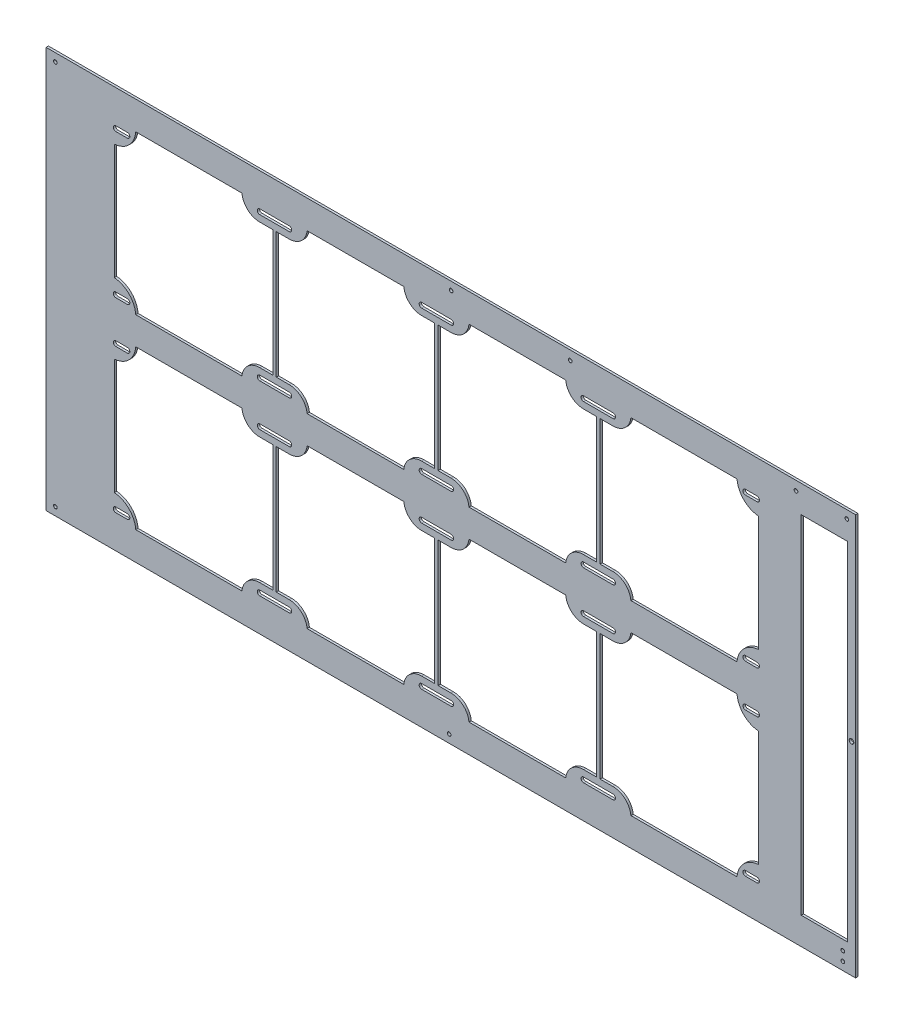
from build123d import *

# Parameters (mm, degrees)
SKETCH1_W          = 700
SKETCH1_H          = 347
SKETCH1_W_2        = 40
SKETCH1_H_2        = 300
BASE_FLANGE1_DEPTH = 2


# Read off the part's stored shape, not the designer's step: top.step
# Sheet-metal steps are written as plain solids
with BuildPart() as part:
    # Base-Flange1: sheet metal written as solids
    # Sketch1 → Base-Flange1 (new body)
    with BuildSketch(Plane.XY):
        with Locations((350, 173.5)):
            Rectangle(SKETCH1_W, SKETCH1_H)
        with BuildLine():
            Line((70.25, 32.9), (60.25, 32.9))
            ThreePointArc((60.25, 32.9), (58.72972042, 32.27027958), (58.1, 30.75))
            ThreePointArc((58.1, 30.75), (58.72972042, 29.22972042), (60.25, 28.6))
            Line((60.25, 28.6), (70.25, 28.6))
            ThreePointArc((70.25, 28.6), (71.77027958, 29.22972042), (72.4, 30.75))
            ThreePointArc((72.4, 30.75), (71.77027958, 32.27027958), (70.25, 32.9))
        make_face(mode=Mode.SUBTRACT)
        with BuildLine():
            Line((184.75, 28.6), (210.25, 28.6))
            ThreePointArc((210.25, 28.6), (211.77027958, 29.22972042), (212.4, 30.75))
            ThreePointArc((212.4, 30.75), (211.77027958, 32.27027958), (210.25, 32.9))
            Line((210.25, 32.9), (184.75, 32.9))
            ThreePointArc((184.75, 32.9), (183.22972042, 32.27027958), (182.6, 30.75))
            ThreePointArc((182.6, 30.75), (183.22972042, 29.22972042), (184.75, 28.6))
        make_face(mode=Mode.SUBTRACT)
        with BuildLine():
            Line((324.75, 28.6), (350.25, 28.6))
            ThreePointArc((350.25, 28.6), (351.77027958, 29.22972042), (352.4, 30.75))
            ThreePointArc((352.4, 30.75), (351.77027958, 32.27027958), (350.25, 32.9))
            Line((350.25, 32.9), (324.75, 32.9))
            ThreePointArc((324.75, 32.9), (323.22972042, 32.27027958), (322.6, 30.75))
            ThreePointArc((322.6, 30.75), (323.22972042, 29.22972042), (324.75, 28.6))
        make_face(mode=Mode.SUBTRACT)
        with BuildLine():
            Line((464.75, 28.6), (490.25, 28.6))
            ThreePointArc((490.25, 28.6), (491.77027958, 29.22972042), (492.4, 30.75))
            ThreePointArc((492.4, 30.75), (491.77027958, 32.27027958), (490.25, 32.9))
            Line((490.25, 32.9), (464.75, 32.9))
            ThreePointArc((464.75, 32.9), (463.22972042, 32.27027958), (462.6, 30.75))
            ThreePointArc((462.6, 30.75), (463.22972042, 29.22972042), (464.75, 28.6))
        make_face(mode=Mode.SUBTRACT)
        with BuildLine():
            Line((614.75, 32.9), (604.75, 32.9))
            ThreePointArc((604.75, 32.9), (603.22972042, 32.27027958), (602.6, 30.75))
            ThreePointArc((602.6, 30.75), (603.22972042, 29.22972042), (604.75, 28.6))
            Line((604.75, 28.6), (614.75, 28.6))
            ThreePointArc((614.75, 28.6), (616.27027958, 29.22972042), (616.9, 30.75))
            ThreePointArc((616.9, 30.75), (616.27027958, 32.27027958), (614.75, 32.9))
        make_face(mode=Mode.SUBTRACT)
        with BuildLine():
            Line((604.75, 153.1), (614.75, 153.1))
            ThreePointArc((614.75, 153.1), (616.27027958, 153.72972042), (616.9, 155.25))
            ThreePointArc((616.9, 155.25), (616.27027958, 156.77027958), (614.75, 157.4))
            Line((614.75, 157.4), (604.75, 157.4))
            ThreePointArc((604.75, 157.4), (603.22972042, 156.77027958), (602.6, 155.25))
            ThreePointArc((602.6, 155.25), (603.22972042, 153.72972042), (604.75, 153.1))
        make_face(mode=Mode.SUBTRACT)
        with BuildLine():
            Line((490.25, 157.4), (464.75, 157.4))
            ThreePointArc((464.75, 157.4), (463.22972042, 156.77027958), (462.6, 155.25))
            ThreePointArc((462.6, 155.25), (463.22972042, 153.72972042), (464.75, 153.1))
            Line((464.75, 153.1), (490.25, 153.1))
            ThreePointArc((490.25, 153.1), (491.77027958, 153.72972042), (492.4, 155.25))
            ThreePointArc((492.4, 155.25), (491.77027958, 156.77027958), (490.25, 157.4))
        make_face(mode=Mode.SUBTRACT)
        with BuildLine():
            Line((350.25, 157.4), (324.75, 157.4))
            ThreePointArc((324.75, 157.4), (323.22972042, 156.77027958), (322.6, 155.25))
            ThreePointArc((322.6, 155.25), (323.22972042, 153.72972042), (324.75, 153.1))
            Line((324.75, 153.1), (350.25, 153.1))
            ThreePointArc((350.25, 153.1), (351.77027958, 153.72972042), (352.4, 155.25))
            ThreePointArc((352.4, 155.25), (351.77027958, 156.77027958), (350.25, 157.4))
        make_face(mode=Mode.SUBTRACT)
        with BuildLine():
            Line((490.25, 147.5), (479, 147.5))
            Line((479, 147.5), (479, 93))
            Line((479, 93), (479, 38.5))
            Line((479, 38.5), (490.25, 38.5))
            ThreePointArc((490.25, 38.5), (500.666333328, 34.478240283), (505.67724862, 24.5))
            Line((505.67724862, 24.5), (547.5, 24.5))
            Line((547.5, 24.5), (597.5, 24.5))
            ThreePointArc((597.5, 24.5), (603.318145396, 37.181854604), (616, 43))
            Line((616, 43), (616, 143))
            ThreePointArc((616, 143), (603.318145396, 148.818145396), (597.5, 161.5))
            Line((597.5, 161.5), (547.5, 161.5))
            Line((547.5, 161.5), (505.67724862, 161.5))
            ThreePointArc((505.67724862, 161.5), (500.666333328, 151.521759717), (490.25, 147.5))
        make_face(mode=Mode.SUBTRACT)
        with BuildLine():
            Line((210.25, 157.4), (184.75, 157.4))
            ThreePointArc((184.75, 157.4), (183.22972042, 156.77027958), (182.6, 155.25))
            ThreePointArc((182.6, 155.25), (183.22972042, 153.72972042), (184.75, 153.1))
            Line((184.75, 153.1), (210.25, 153.1))
            ThreePointArc((210.25, 153.1), (211.77027958, 153.72972042), (212.4, 155.25))
            ThreePointArc((212.4, 155.25), (211.77027958, 156.77027958), (210.25, 157.4))
        make_face(mode=Mode.SUBTRACT)
        with BuildLine():
            Line((476, 147.5), (464.75, 147.5))
            ThreePointArc((464.75, 147.5), (454.333666672, 151.521759717), (449.32275138, 161.5))
            Line((449.32275138, 161.5), (407.5, 161.5))
            Line((407.5, 161.5), (365.67724862, 161.5))
            ThreePointArc((365.67724862, 161.5), (360.666333328, 151.521759717), (350.25, 147.5))
            Line((350.25, 147.5), (339, 147.5))
            Line((339, 147.5), (339, 93))
            Line((339, 93), (339, 38.5))
            Line((339, 38.5), (350.25, 38.5))
            ThreePointArc((350.25, 38.5), (360.666333328, 34.478240283), (365.67724862, 24.5))
            Line((365.67724862, 24.5), (407.5, 24.5))
            Line((407.5, 24.5), (449.32275138, 24.5))
            ThreePointArc((449.32275138, 24.5), (454.333666672, 34.478240283), (464.75, 38.5))
            Line((464.75, 38.5), (476, 38.5))
            Line((476, 38.5), (476, 93))
            Line((476, 93), (476, 147.5))
        make_face(mode=Mode.SUBTRACT)
        with BuildLine():
            Line((60.25, 153.1), (70.25, 153.1))
            ThreePointArc((70.25, 153.1), (71.77027958, 153.72972042), (72.4, 155.25))
            ThreePointArc((72.4, 155.25), (71.77027958, 156.77027958), (70.25, 157.4))
            Line((70.25, 157.4), (60.25, 157.4))
            ThreePointArc((60.25, 157.4), (58.72972042, 156.77027958), (58.1, 155.25))
            ThreePointArc((58.1, 155.25), (58.72972042, 153.72972042), (60.25, 153.1))
        make_face(mode=Mode.SUBTRACT)
        with BuildLine():
            Line((336, 147.5), (324.75, 147.5))
            ThreePointArc((324.75, 147.5), (314.333666672, 151.521759717), (309.32275138, 161.5))
            Line((309.32275138, 161.5), (267.5, 161.5))
            Line((267.5, 161.5), (225.67724862, 161.5))
            ThreePointArc((225.67724862, 161.5), (220.666333328, 151.521759717), (210.25, 147.5))
            Line((210.25, 147.5), (199, 147.5))
            Line((199, 147.5), (199, 93))
            Line((199, 93), (199, 38.5))
            Line((199, 38.5), (210.25, 38.5))
            ThreePointArc((210.25, 38.5), (220.666333328, 34.478240283), (225.677248621, 24.5))
            Line((225.677248621, 24.5), (267.5, 24.5))
            Line((267.5, 24.5), (309.32275138, 24.5))
            ThreePointArc((309.32275138, 24.5), (314.333666672, 34.478240283), (324.75, 38.5))
            Line((324.75, 38.5), (336, 38.5))
            Line((336, 38.5), (336, 93))
            Line((336, 93), (336, 147.5))
        make_face(mode=Mode.SUBTRACT)
        with BuildLine():
            Line((464.75, 189.6), (490.25, 189.6))
            ThreePointArc((490.25, 189.6), (491.77027958, 190.22972042), (492.4, 191.75))
            ThreePointArc((492.4, 191.75), (491.77027958, 193.27027958), (490.25, 193.9))
            Line((490.25, 193.9), (464.75, 193.9))
            ThreePointArc((464.75, 193.9), (463.22972042, 193.27027958), (462.6, 191.75))
            ThreePointArc((462.6, 191.75), (463.22972042, 190.22972042), (464.75, 189.6))
        make_face(mode=Mode.SUBTRACT)
        with BuildLine():
            Line((196, 147.5), (184.75, 147.5))
            ThreePointArc((184.75, 147.5), (174.333666672, 151.521759717), (169.322751379, 161.5))
            Line((169.322751379, 161.5), (127.5, 161.5))
            Line((127.5, 161.5), (77.5, 161.5))
            ThreePointArc((77.5, 161.5), (71.681854604, 148.818145396), (59, 143))
            Line((59, 143), (59, 43))
            ThreePointArc((59, 43), (71.681854604, 37.181854604), (77.5, 24.5))
            Line((77.5, 24.5), (127.5, 24.5))
            Line((127.5, 24.5), (169.32275138, 24.5))
            ThreePointArc((169.32275138, 24.5), (174.333666672, 34.478240283), (184.75, 38.5))
            Line((184.75, 38.5), (196, 38.5))
            Line((196, 38.5), (196, 93))
            Line((196, 93), (196, 147.5))
        make_face(mode=Mode.SUBTRACT)
        with BuildLine():
            Line((614.75, 193.9), (604.75, 193.9))
            ThreePointArc((604.75, 193.9), (603.22972042, 193.27027958), (602.6, 191.75))
            ThreePointArc((602.6, 191.75), (603.22972042, 190.22972042), (604.75, 189.6))
            Line((604.75, 189.6), (614.75, 189.6))
            ThreePointArc((614.75, 189.6), (616.27027958, 190.22972042), (616.9, 191.75))
            ThreePointArc((616.9, 191.75), (616.27027958, 193.27027958), (614.75, 193.9))
        make_face(mode=Mode.SUBTRACT)
        with BuildLine():
            Line((604.75, 314.1), (614.75, 314.1))
            ThreePointArc((614.75, 314.1), (616.27027958, 314.72972042), (616.9, 316.25))
            ThreePointArc((616.9, 316.25), (616.27027958, 317.77027958), (614.75, 318.4))
            Line((614.75, 318.4), (604.75, 318.4))
            ThreePointArc((604.75, 318.4), (603.22972042, 317.77027958), (602.6, 316.25))
            ThreePointArc((602.6, 316.25), (603.22972042, 314.72972042), (604.75, 314.1))
        make_face(mode=Mode.SUBTRACT)
        with BuildLine():
            Line((490.25, 318.4), (464.75, 318.4))
            ThreePointArc((464.75, 318.4), (463.22972042, 317.77027958), (462.6, 316.25))
            ThreePointArc((462.6, 316.25), (463.22972042, 314.72972042), (464.75, 314.1))
            Line((464.75, 314.1), (490.25, 314.1))
            ThreePointArc((490.25, 314.1), (491.77027958, 314.72972042), (492.4, 316.25))
            ThreePointArc((492.4, 316.25), (491.77027958, 317.77027958), (490.25, 318.4))
        make_face(mode=Mode.SUBTRACT)
        with BuildLine():
            Line((324.75, 189.6), (350.25, 189.6))
            ThreePointArc((350.25, 189.6), (351.77027958, 190.22972042), (352.4, 191.75))
            ThreePointArc((352.4, 191.75), (351.77027958, 193.27027958), (350.25, 193.9))
            Line((350.25, 193.9), (324.75, 193.9))
            ThreePointArc((324.75, 193.9), (323.22972042, 193.27027958), (322.6, 191.75))
            ThreePointArc((322.6, 191.75), (323.22972042, 190.22972042), (324.75, 189.6))
        make_face(mode=Mode.SUBTRACT)
        with BuildLine():
            Line((490.25, 308.5), (479, 308.5))
            Line((479, 308.5), (479, 254))
            Line((479, 254), (479, 199.5))
            Line((479, 199.5), (490.25, 199.5))
            ThreePointArc((490.25, 199.5), (500.666333328, 195.478240283), (505.67724862, 185.5))
            Line((505.67724862, 185.5), (547.5, 185.5))
            Line((547.5, 185.5), (597.5, 185.5))
            ThreePointArc((597.5, 185.5), (603.318145396, 198.181854604), (616, 204))
            Line((616, 204), (616, 304))
            ThreePointArc((616, 304), (603.318145396, 309.818145396), (597.5, 322.5))
            Line((597.5, 322.5), (547.5, 322.5))
            Line((547.5, 322.5), (505.67724862, 322.5))
            ThreePointArc((505.67724862, 322.5), (500.666333328, 312.521759717), (490.25, 308.5))
        make_face(mode=Mode.SUBTRACT)
        with BuildLine():
            Line((70.25, 193.9), (60.25, 193.9))
            ThreePointArc((60.25, 193.9), (58.72972042, 193.27027958), (58.1, 191.75))
            ThreePointArc((58.1, 191.75), (58.72972042, 190.22972042), (60.25, 189.6))
            Line((60.25, 189.6), (70.25, 189.6))
            ThreePointArc((70.25, 189.6), (71.77027958, 190.22972042), (72.4, 191.75))
            ThreePointArc((72.4, 191.75), (71.77027958, 193.27027958), (70.25, 193.9))
        make_face(mode=Mode.SUBTRACT)
        with BuildLine():
            Line((476, 308.5), (464.75, 308.5))
            ThreePointArc((464.75, 308.5), (454.333666672, 312.521759717), (449.32275138, 322.5))
            Line((449.32275138, 322.5), (407.5, 322.5))
            Line((407.5, 322.5), (365.67724862, 322.5))
            ThreePointArc((365.67724862, 322.5), (360.666333328, 312.521759717), (350.25, 308.5))
            Line((350.25, 308.5), (339, 308.5))
            Line((339, 308.5), (339, 254))
            Line((339, 254), (339, 199.5))
            Line((339, 199.5), (350.25, 199.5))
            ThreePointArc((350.25, 199.5), (360.666333328, 195.478240283), (365.67724862, 185.5))
            Line((365.67724862, 185.5), (407.5, 185.5))
            Line((407.5, 185.5), (449.32275138, 185.5))
            ThreePointArc((449.32275138, 185.5), (454.333666672, 195.478240283), (464.75, 199.5))
            Line((464.75, 199.5), (476, 199.5))
            Line((476, 199.5), (476, 254))
            Line((476, 254), (476, 308.5))
        make_face(mode=Mode.SUBTRACT)
        with BuildLine():
            Line((184.75, 189.6), (210.25, 189.6))
            ThreePointArc((210.25, 189.6), (211.77027958, 190.22972042), (212.4, 191.75))
            ThreePointArc((212.4, 191.75), (211.77027958, 193.27027958), (210.25, 193.9))
            Line((210.25, 193.9), (184.75, 193.9))
            ThreePointArc((184.75, 193.9), (183.22972042, 193.27027958), (182.6, 191.75))
            ThreePointArc((182.6, 191.75), (183.22972042, 190.22972042), (184.75, 189.6))
        make_face(mode=Mode.SUBTRACT)
        with BuildLine():
            Line((350.25, 318.4), (324.75, 318.4))
            ThreePointArc((324.75, 318.4), (323.22972042, 317.77027958), (322.6, 316.25))
            ThreePointArc((322.6, 316.25), (323.22972042, 314.72972042), (324.75, 314.1))
            Line((324.75, 314.1), (350.25, 314.1))
            ThreePointArc((350.25, 314.1), (351.77027958, 314.72972042), (352.4, 316.25))
            ThreePointArc((352.4, 316.25), (351.77027958, 317.77027958), (350.25, 318.4))
        make_face(mode=Mode.SUBTRACT)
        with BuildLine():
            Line((210.25, 318.4), (184.75, 318.4))
            ThreePointArc((184.75, 318.4), (183.22972042, 317.77027958), (182.6, 316.25))
            ThreePointArc((182.6, 316.25), (183.22972042, 314.72972042), (184.75, 314.1))
            Line((184.75, 314.1), (210.25, 314.1))
            ThreePointArc((210.25, 314.1), (211.77027958, 314.72972042), (212.4, 316.25))
            ThreePointArc((212.4, 316.25), (211.77027958, 317.77027958), (210.25, 318.4))
        make_face(mode=Mode.SUBTRACT)
        with BuildLine():
            Line((60.25, 314.1), (70.25, 314.1))
            ThreePointArc((70.25, 314.1), (71.77027958, 314.72972042), (72.4, 316.25))
            ThreePointArc((72.4, 316.25), (71.77027958, 317.77027958), (70.25, 318.4))
            Line((70.25, 318.4), (60.25, 318.4))
            ThreePointArc((60.25, 318.4), (58.72972042, 317.77027958), (58.1, 316.25))
            ThreePointArc((58.1, 316.25), (58.72972042, 314.72972042), (60.25, 314.1))
        make_face(mode=Mode.SUBTRACT)
        with BuildLine():
            Line((336, 308.5), (324.75, 308.5))
            ThreePointArc((324.75, 308.5), (314.333666672, 312.521759717), (309.32275138, 322.5))
            Line((309.32275138, 322.5), (267.5, 322.5))
            Line((267.5, 322.5), (225.67724862, 322.5))
            ThreePointArc((225.67724862, 322.5), (220.666333328, 312.521759717), (210.25, 308.5))
            Line((210.25, 308.5), (199, 308.5))
            Line((199, 308.5), (199, 254))
            Line((199, 254), (199, 199.5))
            Line((199, 199.5), (210.25, 199.5))
            ThreePointArc((210.25, 199.5), (220.666333328, 195.478240283), (225.677248621, 185.5))
            Line((225.677248621, 185.5), (267.5, 185.5))
            Line((267.5, 185.5), (309.32275138, 185.5))
            ThreePointArc((309.32275138, 185.5), (314.333666672, 195.478240283), (324.75, 199.5))
            Line((324.75, 199.5), (336, 199.5))
            Line((336, 199.5), (336, 254))
            Line((336, 254), (336, 308.5))
        make_face(mode=Mode.SUBTRACT)
        with BuildLine():
            Line((196, 308.5), (184.75, 308.5))
            ThreePointArc((184.75, 308.5), (174.333666672, 312.521759717), (169.322751379, 322.5))
            Line((169.322751379, 322.5), (127.5, 322.5))
            Line((127.5, 322.5), (77.5, 322.5))
            ThreePointArc((77.5, 322.5), (71.681854604, 309.818145396), (59, 304))
            Line((59, 304), (59, 204))
            ThreePointArc((59, 204), (71.681854604, 198.181854604), (77.5, 185.5))
            Line((77.5, 185.5), (127.5, 185.5))
            Line((127.5, 185.5), (169.32275138, 185.5))
            ThreePointArc((169.32275138, 185.5), (174.333666672, 195.478240283), (184.75, 199.5))
            Line((184.75, 199.5), (196, 199.5))
            Line((196, 199.5), (196, 254))
            Line((196, 254), (196, 308.5))
        make_face(mode=Mode.SUBTRACT)
        with Locations((673, 173.5)):
            Rectangle(SKETCH1_W_2, SKETCH1_H_2, mode=Mode.SUBTRACT)
        with BuildLine():
            add(Edge.make_bspline(
                [(9.6, 7), (9.599144796, 7.04043287), (9.597441601, 7.120957526), (9.583449234, 7.240793796), (9.561050517, 7.358924454), (9.529434689, 7.475353212), (9.46628832, 7.653854822), (9.347212978, 7.884948009), (9.139077952, 8.138958261), (8.885002964, 8.347138577), (8.630089511, 8.478661896), (8.39905452, 8.553787683), (8.201116482, 8.592917963), (8.067225889, 8.597632734), (8, 8.6)],
                knots=[0, 0, 0, 0, 0.048300702, 0.096193949, 0.143954901, 0.191860997, 0.24018718, 0.370073141, 0.500049556, 0.629923419, 0.759911847, 0.840126742, 0.919728328, 1, 1, 1, 1], degree=3))
            add(Edge.make_bspline(
                [(8, 8.6), (7.959573718, 8.599144722), (7.879058925, 8.597441312), (7.759232655, 8.583448437), (7.641102154, 8.561049558), (7.524664006, 8.529432932), (7.34615859, 8.466299068), (7.115054797, 8.347226567), (6.861043824, 8.139075913), (6.652847378, 7.885000304), (6.521328201, 7.630072821), (6.446216726, 7.399034858), (6.407083189, 7.201098259), (6.402367544, 7.067216771), (6.4, 7)],
                knots=[0, 0, 0, 0, 0.048292834, 0.09618217, 0.143943123, 0.191853023, 0.240186632, 0.370060815, 0.500049535, 0.629935723, 0.759912354, 0.840137637, 0.919739226, 1, 1, 1, 1], degree=3))
            add(Edge.make_bspline(
                [(6.4, 7), (6.400855204, 6.95956713), (6.402558399, 6.879042474), (6.416550766, 6.759206204), (6.438949483, 6.641075546), (6.470565311, 6.524646788), (6.53371168, 6.346145178), (6.652787022, 6.115051991), (6.860922048, 5.861041739), (7.114997036, 5.652861423), (7.369910489, 5.521338104), (7.60094548, 5.446212317), (7.798883518, 5.407082037), (7.932774111, 5.402367266), (8, 5.4)],
                knots=[0, 0, 0, 0, 0.048300702, 0.096193949, 0.143954901, 0.191860997, 0.24018718, 0.370073141, 0.500049556, 0.629923419, 0.759911847, 0.840126742, 0.919728328, 1, 1, 1, 1], degree=3))
            add(Edge.make_bspline(
                [(8, 5.4), (8.040426282, 5.400855278), (8.120941075, 5.402558688), (8.240767345, 5.416551563), (8.358897846, 5.438950442), (8.475335994, 5.470567068), (8.65384141, 5.533700932), (8.884945203, 5.652773433), (9.138956176, 5.860924087), (9.347152622, 6.114999696), (9.478671799, 6.369927179), (9.553783274, 6.600965142), (9.592916811, 6.798901741), (9.597632456, 6.932783229), (9.6, 7)],
                knots=[0, 0, 0, 0, 0.048292834, 0.09618217, 0.143943123, 0.191853023, 0.240186632, 0.370060815, 0.500049535, 0.629935723, 0.759912354, 0.840137637, 0.919739226, 1, 1, 1, 1], degree=3))
        make_face(mode=Mode.SUBTRACT)
        with BuildLine():
            add(Edge.make_bspline(
                [(350.1, 7), (350.099144796, 7.04043287), (350.097441601, 7.120957526), (350.083449234, 7.240793796), (350.061050517, 7.358924454), (350.029434689, 7.475353212), (349.96628832, 7.653854822), (349.847212978, 7.884948009), (349.639077952, 8.138958261), (349.385002964, 8.347138577), (349.130089511, 8.478661896), (348.89905452, 8.553787683), (348.701116482, 8.592917963), (348.567225889, 8.597632734), (348.5, 8.6)],
                knots=[0, 0, 0, 0, 0.048300702, 0.096193949, 0.143954901, 0.191860997, 0.24018718, 0.370073141, 0.500049556, 0.629923419, 0.759911847, 0.840126742, 0.919728328, 1, 1, 1, 1], degree=3))
            add(Edge.make_bspline(
                [(348.5, 8.6), (348.459573718, 8.599144722), (348.379058925, 8.597441312), (348.259232655, 8.583448437), (348.141102154, 8.561049558), (348.024664006, 8.529432932), (347.84615859, 8.466299068), (347.615054797, 8.347226567), (347.361043824, 8.139075913), (347.152847378, 7.885000304), (347.021328201, 7.630072821), (346.946216726, 7.399034858), (346.907083189, 7.201098259), (346.902367544, 7.067216771), (346.9, 7)],
                knots=[0, 0, 0, 0, 0.048292834, 0.09618217, 0.143943123, 0.191853023, 0.240186632, 0.370060815, 0.500049535, 0.629935723, 0.759912354, 0.840137637, 0.919739226, 1, 1, 1, 1], degree=3))
            add(Edge.make_bspline(
                [(346.9, 7), (346.900855204, 6.95956713), (346.902558399, 6.879042474), (346.916550766, 6.759206204), (346.938949483, 6.641075546), (346.970565311, 6.524646788), (347.03371168, 6.346145178), (347.152787022, 6.115051991), (347.360922048, 5.861041739), (347.614997036, 5.652861423), (347.869910489, 5.521338104), (348.10094548, 5.446212317), (348.298883518, 5.407082037), (348.432774111, 5.402367266), (348.5, 5.4)],
                knots=[0, 0, 0, 0, 0.048300702, 0.096193949, 0.143954901, 0.191860997, 0.24018718, 0.370073141, 0.500049556, 0.629923419, 0.759911847, 0.840126742, 0.919728328, 1, 1, 1, 1], degree=3))
            add(Edge.make_bspline(
                [(348.5, 5.4), (348.540426282, 5.400855278), (348.620941075, 5.402558688), (348.740767345, 5.416551563), (348.858897846, 5.438950442), (348.975335994, 5.470567068), (349.15384141, 5.533700932), (349.384945203, 5.652773433), (349.638956176, 5.860924087), (349.847152622, 6.114999696), (349.978671799, 6.369927179), (350.053783274, 6.600965142), (350.092916811, 6.798901741), (350.097632456, 6.932783229), (350.1, 7)],
                knots=[0, 0, 0, 0, 0.048292834, 0.09618217, 0.143943124, 0.191853023, 0.240186632, 0.370060815, 0.500049535, 0.629935723, 0.759912354, 0.840137637, 0.919739226, 1, 1, 1, 1], degree=3))
        make_face(mode=Mode.SUBTRACT)
        with BuildLine():
            add(Edge.make_bspline(
                [(690.6, 7), (690.599144796, 7.04043287), (690.597441601, 7.120957526), (690.583449234, 7.240793797), (690.561050517, 7.358924454), (690.529434689, 7.475353212), (690.46628832, 7.653854822), (690.347212978, 7.884948009), (690.139077952, 8.138958261), (689.885002964, 8.347138577), (689.630089511, 8.478661896), (689.39905452, 8.553787683), (689.201116482, 8.592917963), (689.067225889, 8.597632734), (689, 8.6)],
                knots=[0, 0, 0, 0, 0.048300702, 0.096193949, 0.143954901, 0.191860997, 0.24018718, 0.370073141, 0.500049556, 0.629923419, 0.759911847, 0.840126742, 0.919728328, 1, 1, 1, 1], degree=3))
            add(Edge.make_bspline(
                [(689, 8.6), (688.959573718, 8.599144722), (688.879058925, 8.597441312), (688.759232655, 8.583448437), (688.641102154, 8.561049558), (688.524664006, 8.529432932), (688.34615859, 8.466299068), (688.115054797, 8.347226567), (687.861043824, 8.139075913), (687.652847378, 7.885000304), (687.521328201, 7.630072821), (687.446216726, 7.399034858), (687.407083189, 7.201098259), (687.402367544, 7.067216771), (687.4, 7)],
                knots=[0, 0, 0, 0, 0.048292834, 0.09618217, 0.143943123, 0.191853023, 0.240186632, 0.370060815, 0.500049535, 0.629935723, 0.759912354, 0.840137637, 0.919739226, 1, 1, 1, 1], degree=3))
            add(Edge.make_bspline(
                [(687.4, 7), (687.400855204, 6.95956713), (687.402558399, 6.879042474), (687.416550766, 6.759206204), (687.438949483, 6.641075546), (687.470565311, 6.524646788), (687.53371168, 6.346145178), (687.652787022, 6.115051991), (687.860922048, 5.861041739), (688.114997036, 5.652861423), (688.369910489, 5.521338104), (688.60094548, 5.446212317), (688.798883518, 5.407082037), (688.932774111, 5.402367266), (689, 5.4)],
                knots=[0, 0, 0, 0, 0.048300702, 0.096193949, 0.143954901, 0.191860997, 0.24018718, 0.370073141, 0.500049556, 0.629923419, 0.759911847, 0.840126742, 0.919728328, 1, 1, 1, 1], degree=3))
            add(Edge.make_bspline(
                [(689, 5.4), (689.040426282, 5.400855278), (689.120941075, 5.402558688), (689.240767345, 5.416551563), (689.358897846, 5.438950442), (689.475335994, 5.470567068), (689.65384141, 5.533700932), (689.884945203, 5.652773433), (690.138956176, 5.860924087), (690.347152622, 6.114999696), (690.478671799, 6.369927179), (690.553783274, 6.600965142), (690.592916811, 6.798901741), (690.597632456, 6.932783229), (690.6, 7)],
                knots=[0, 0, 0, 0, 0.048292834, 0.09618217, 0.143943124, 0.191853023, 0.240186632, 0.370060815, 0.500049535, 0.629935723, 0.759912354, 0.840137637, 0.919739226, 1, 1, 1, 1], degree=3))
        make_face(mode=Mode.SUBTRACT)
        with BuildLine():
            add(Edge.make_bspline(
                [(690.6, 15), (690.599144796, 15.04043287), (690.597441601, 15.120957526), (690.583449234, 15.240793797), (690.561050517, 15.358924454), (690.529434689, 15.475353212), (690.46628832, 15.653854822), (690.347212978, 15.884948009), (690.139077952, 16.138958261), (689.885002964, 16.347138577), (689.630089511, 16.478661896), (689.39905452, 16.553787683), (689.201116482, 16.592917963), (689.067225889, 16.597632734), (689, 16.6)],
                knots=[0, 0, 0, 0, 0.048300702, 0.096193949, 0.143954901, 0.191860997, 0.24018718, 0.370073141, 0.500049556, 0.629923419, 0.759911847, 0.840126742, 0.919728328, 1, 1, 1, 1], degree=3))
            add(Edge.make_bspline(
                [(689, 16.6), (688.959573718, 16.599144722), (688.879058925, 16.597441312), (688.759232655, 16.583448437), (688.641102154, 16.561049558), (688.524664006, 16.529432932), (688.34615859, 16.466299068), (688.115054797, 16.347226567), (687.861043824, 16.139075913), (687.652847378, 15.885000304), (687.521328201, 15.630072821), (687.446216726, 15.399034858), (687.407083189, 15.201098259), (687.402367544, 15.067216771), (687.4, 15)],
                knots=[0, 0, 0, 0, 0.048292834, 0.09618217, 0.143943123, 0.191853023, 0.240186632, 0.370060815, 0.500049535, 0.629935723, 0.759912354, 0.840137637, 0.919739226, 1, 1, 1, 1], degree=3))
            add(Edge.make_bspline(
                [(687.4, 15), (687.400855204, 14.95956713), (687.402558399, 14.879042474), (687.416550766, 14.759206203), (687.438949483, 14.641075546), (687.470565311, 14.524646788), (687.53371168, 14.346145178), (687.652787022, 14.115051991), (687.860922048, 13.861041739), (688.114997037, 13.652861423), (688.369910489, 13.521338104), (688.60094548, 13.446212317), (688.798883518, 13.407082037), (688.932774111, 13.402367266), (689, 13.4)],
                knots=[0, 0, 0, 0, 0.048300702, 0.096193949, 0.143954901, 0.191860997, 0.24018718, 0.370073141, 0.500049556, 0.629923419, 0.759911847, 0.840126742, 0.919728328, 1, 1, 1, 1], degree=3))
            add(Edge.make_bspline(
                [(689, 13.4), (689.040426282, 13.400855278), (689.120941075, 13.402558688), (689.240767345, 13.416551563), (689.358897846, 13.438950442), (689.475335994, 13.470567068), (689.65384141, 13.533700932), (689.884945203, 13.652773433), (690.138956176, 13.860924087), (690.347152622, 14.114999696), (690.478671799, 14.369927179), (690.553783274, 14.600965142), (690.592916811, 14.798901741), (690.597632456, 14.932783229), (690.6, 15)],
                knots=[0, 0, 0, 0, 0.048292834, 0.09618217, 0.143943124, 0.191853023, 0.240186632, 0.370060815, 0.500049535, 0.629935723, 0.759912354, 0.840137637, 0.919739226, 1, 1, 1, 1], degree=3))
        make_face(mode=Mode.SUBTRACT)
        with BuildLine():
            add(Edge.make_bspline(
                [(696.5, 177.5), (696.457848659, 177.499256604), (696.373873685, 177.497775593), (696.248720384, 177.485640525), (696.125036498, 177.466220056), (696.00283133, 177.438823398), (695.882096956, 177.403624251), (695.675188909, 177.328994717), (695.393801952, 177.184025771), (695.076291088, 176.923829938), (694.816054893, 176.606241283), (694.65165374, 176.287579454), (694.557772895, 175.998785275), (694.508854428, 175.751365255), (694.502959534, 175.584017173), (694.5, 175.5)],
                knots=[0, 0, 0, 0, 0.04028519, 0.080257179, 0.120074508, 0.159897561, 0.199886658, 0.240200133, 0.370083477, 0.500058452, 0.629951402, 0.759916706, 0.840144054, 0.919744257, 1, 1, 1, 1], degree=3))
            add(Edge.make_bspline(
                [(694.5, 175.5), (694.500743352, 175.45784294), (694.502224235, 175.37385883), (694.514359036, 175.248695193), (694.533779296, 175.125007771), (694.561175862, 175.002805927), (694.596374496, 174.882081523), (694.671016167, 174.67517651), (694.815987683, 174.393799091), (695.076168063, 174.076289015), (695.393756047, 173.816068931), (695.712403857, 173.651663643), (696.001195061, 173.557768486), (696.248616519, 173.508853276), (696.415973708, 173.502959256), (696.5, 173.5)],
                knots=[0, 0, 0, 0, 0.040290654, 0.080265908, 0.120084315, 0.1599063, 0.199892245, 0.240200575, 0.370093343, 0.500058472, 0.629941562, 0.759916301, 0.840135338, 0.919735539, 1, 1, 1, 1], degree=3))
            add(Edge.make_bspline(
                [(696.5, 173.5), (696.542151341, 173.500743396), (696.626126315, 173.502224407), (696.751279616, 173.514359475), (696.874963502, 173.533779944), (696.99716867, 173.561176602), (697.117903044, 173.596375749), (697.32481109, 173.671005283), (697.606198048, 173.815974229), (697.923708912, 174.076170062), (698.183945108, 174.393758717), (698.34834626, 174.712420546), (698.442227105, 175.001214725), (698.491145572, 175.248634745), (698.497040466, 175.415982827), (698.5, 175.5)],
                knots=[0, 0, 0, 0, 0.04028519, 0.080257179, 0.120074508, 0.159897561, 0.199886658, 0.240200133, 0.370083477, 0.500058452, 0.629951402, 0.759916706, 0.840144054, 0.919744257, 1, 1, 1, 1], degree=3))
            add(Edge.make_bspline(
                [(698.5, 175.5), (698.499256648, 175.54215706), (698.497775765, 175.626141171), (698.485640964, 175.751304807), (698.466220704, 175.87499223), (698.438824138, 175.997194073), (698.403625504, 176.117918478), (698.328983833, 176.32482349), (698.184012317, 176.606200909), (697.923831937, 176.923710985), (697.606243953, 177.183931069), (697.287596143, 177.348336357), (696.998804939, 177.442231514), (696.751383481, 177.491146724), (696.584026292, 177.497040744), (696.5, 177.5)],
                knots=[0, 0, 0, 0, 0.040290654, 0.080265908, 0.120084316, 0.159906301, 0.199892245, 0.240200575, 0.370093343, 0.500058472, 0.629941562, 0.759916301, 0.840135338, 0.919735539, 1, 1, 1, 1], degree=3))
        make_face(mode=Mode.SUBTRACT)
        with BuildLine():
            add(Edge.make_bspline(
                [(694.1, 340), (694.099144796, 340.04043287), (694.097441601, 340.120957526), (694.083449234, 340.240793797), (694.061050517, 340.358924454), (694.029434689, 340.475353212), (693.96628832, 340.653854822), (693.847212978, 340.884948009), (693.639077952, 341.138958261), (693.385002964, 341.347138577), (693.130089511, 341.478661896), (692.899054519, 341.553787683), (692.701116482, 341.592917963), (692.567225889, 341.597632734), (692.5, 341.6)],
                knots=[0, 0, 0, 0, 0.048300702, 0.096193949, 0.143954901, 0.191860997, 0.24018718, 0.370073141, 0.500049556, 0.629923419, 0.759911847, 0.840126742, 0.919728328, 1, 1, 1, 1], degree=3))
            add(Edge.make_bspline(
                [(692.5, 341.6), (692.459573718, 341.599144722), (692.379058925, 341.597441312), (692.259232655, 341.583448437), (692.141102154, 341.561049558), (692.024664006, 341.529432932), (691.84615859, 341.466299068), (691.615054797, 341.347226567), (691.361043824, 341.139075913), (691.152847378, 340.885000304), (691.021328201, 340.630072821), (690.946216726, 340.399034858), (690.907083189, 340.201098259), (690.902367544, 340.067216771), (690.9, 340)],
                knots=[0, 0, 0, 0, 0.048292834, 0.09618217, 0.143943123, 0.191853023, 0.240186632, 0.370060815, 0.500049535, 0.629935723, 0.759912354, 0.840137637, 0.919739226, 1, 1, 1, 1], degree=3))
            add(Edge.make_bspline(
                [(690.9, 340), (690.900855204, 339.95956713), (690.902558399, 339.879042474), (690.916550766, 339.759206204), (690.938949483, 339.641075546), (690.970565311, 339.524646788), (691.03371168, 339.346145178), (691.152787022, 339.115051991), (691.360922048, 338.861041739), (691.614997036, 338.652861423), (691.869910489, 338.521338104), (692.10094548, 338.446212317), (692.298883517, 338.407082037), (692.432774111, 338.402367266), (692.5, 338.4)],
                knots=[0, 0, 0, 0, 0.048300702, 0.096193949, 0.143954901, 0.191860997, 0.24018718, 0.370073141, 0.500049556, 0.629923419, 0.759911847, 0.840126742, 0.919728328, 1, 1, 1, 1], degree=3))
            add(Edge.make_bspline(
                [(692.5, 338.4), (692.540426282, 338.400855278), (692.620941075, 338.402558688), (692.740767345, 338.416551563), (692.858897846, 338.438950442), (692.975335994, 338.470567068), (693.15384141, 338.533700932), (693.384945203, 338.652773433), (693.638956176, 338.860924087), (693.847152623, 339.114999696), (693.978671799, 339.369927179), (694.053783274, 339.600965142), (694.092916811, 339.798901741), (694.097632456, 339.932783229), (694.1, 340)],
                knots=[0, 0, 0, 0, 0.048292834, 0.09618217, 0.143943123, 0.191853023, 0.240186632, 0.370060815, 0.500049535, 0.629935723, 0.759912354, 0.840137637, 0.919739226, 1, 1, 1, 1], degree=3))
        make_face(mode=Mode.SUBTRACT)
        with BuildLine():
            add(Edge.make_bspline(
                [(650.1, 339.05), (650.099144796, 339.09043287), (650.097441601, 339.170957526), (650.083449234, 339.290793797), (650.061050517, 339.408924454), (650.029434689, 339.525353212), (649.96628832, 339.703854822), (649.847212978, 339.934948009), (649.639077952, 340.188958261), (649.385002964, 340.397138577), (649.130089511, 340.528661896), (648.89905452, 340.603787683), (648.701116482, 340.642917963), (648.567225889, 340.647632734), (648.5, 340.65)],
                knots=[0, 0, 0, 0, 0.048300702, 0.096193949, 0.143954901, 0.191860997, 0.24018718, 0.370073141, 0.500049556, 0.629923419, 0.759911847, 0.840126742, 0.919728328, 1, 1, 1, 1], degree=3))
            add(Edge.make_bspline(
                [(648.5, 340.65), (648.459573718, 340.649144722), (648.379058925, 340.647441312), (648.259232655, 340.633448437), (648.141102154, 340.611049558), (648.024664006, 340.579432932), (647.84615859, 340.516299068), (647.615054797, 340.397226567), (647.361043824, 340.189075913), (647.152847378, 339.935000304), (647.021328201, 339.680072821), (646.946216726, 339.449034858), (646.907083189, 339.251098259), (646.902367544, 339.117216771), (646.9, 339.05)],
                knots=[0, 0, 0, 0, 0.048292834, 0.09618217, 0.143943123, 0.191853023, 0.240186632, 0.370060815, 0.500049535, 0.629935723, 0.759912354, 0.840137637, 0.919739226, 1, 1, 1, 1], degree=3))
            add(Edge.make_bspline(
                [(646.9, 339.05), (646.900855204, 339.00956713), (646.902558399, 338.929042474), (646.916550766, 338.809206204), (646.938949483, 338.691075546), (646.970565311, 338.574646788), (647.03371168, 338.396145178), (647.152787022, 338.165051991), (647.360922048, 337.911041739), (647.614997036, 337.702861423), (647.869910489, 337.571338104), (648.10094548, 337.496212317), (648.298883518, 337.457082037), (648.432774111, 337.452367266), (648.5, 337.45)],
                knots=[0, 0, 0, 0, 0.048300702, 0.096193949, 0.143954901, 0.191860997, 0.24018718, 0.370073141, 0.500049556, 0.629923419, 0.759911847, 0.840126742, 0.919728328, 1, 1, 1, 1], degree=3))
            add(Edge.make_bspline(
                [(648.5, 337.45), (648.540426282, 337.450855278), (648.620941075, 337.452558688), (648.740767345, 337.466551563), (648.858897846, 337.488950442), (648.975335994, 337.520567068), (649.15384141, 337.583700932), (649.384945203, 337.702773433), (649.638956176, 337.910924087), (649.847152622, 338.164999696), (649.978671799, 338.419927179), (650.053783274, 338.650965142), (650.092916811, 338.848901741), (650.097632456, 338.982783229), (650.1, 339.05)],
                knots=[0, 0, 0, 0, 0.048292834, 0.09618217, 0.143943123, 0.191853023, 0.240186632, 0.370060815, 0.500049535, 0.629935723, 0.759912354, 0.840137637, 0.919739226, 1, 1, 1, 1], degree=3))
        make_face(mode=Mode.SUBTRACT)
        with BuildLine():
            add(Edge.make_bspline(
                [(454.9, 339.05), (454.899144796, 339.09043287), (454.897441601, 339.170957526), (454.883449234, 339.290793796), (454.861050517, 339.408924454), (454.829434689, 339.525353212), (454.76628832, 339.703854822), (454.647212978, 339.934948009), (454.439077952, 340.188958261), (454.185002964, 340.397138577), (453.930089511, 340.528661896), (453.69905452, 340.603787683), (453.501116482, 340.642917963), (453.367225889, 340.647632734), (453.3, 340.65)],
                knots=[0, 0, 0, 0, 0.048300702, 0.096193949, 0.143954901, 0.191860997, 0.24018718, 0.370073141, 0.500049556, 0.629923419, 0.759911847, 0.840126742, 0.919728328, 1, 1, 1, 1], degree=3))
            add(Edge.make_bspline(
                [(453.3, 340.65), (453.259573718, 340.649144722), (453.179058925, 340.647441312), (453.059232655, 340.633448437), (452.941102154, 340.611049558), (452.824664006, 340.579432932), (452.64615859, 340.516299068), (452.415054797, 340.397226567), (452.161043824, 340.189075913), (451.952847378, 339.935000304), (451.821328201, 339.680072821), (451.746216726, 339.449034858), (451.707083189, 339.251098259), (451.702367544, 339.117216771), (451.7, 339.05)],
                knots=[0, 0, 0, 0, 0.048292834, 0.09618217, 0.143943124, 0.191853023, 0.240186632, 0.370060815, 0.500049535, 0.629935723, 0.759912354, 0.840137637, 0.919739226, 1, 1, 1, 1], degree=3))
            add(Edge.make_bspline(
                [(451.7, 339.05), (451.700855204, 339.00956713), (451.702558399, 338.929042474), (451.716550766, 338.809206204), (451.738949483, 338.691075546), (451.770565311, 338.574646788), (451.83371168, 338.396145178), (451.952787022, 338.165051991), (452.160922048, 337.911041739), (452.414997036, 337.702861423), (452.669910489, 337.571338104), (452.90094548, 337.496212317), (453.098883518, 337.457082037), (453.232774111, 337.452367266), (453.3, 337.45)],
                knots=[0, 0, 0, 0, 0.048300702, 0.096193949, 0.143954901, 0.191860997, 0.24018718, 0.370073141, 0.500049556, 0.629923419, 0.759911847, 0.840126742, 0.919728328, 1, 1, 1, 1], degree=3))
            add(Edge.make_bspline(
                [(453.3, 337.45), (453.340426282, 337.450855278), (453.420941075, 337.452558688), (453.540767345, 337.466551563), (453.658897846, 337.488950442), (453.775335994, 337.520567068), (453.95384141, 337.583700932), (454.184945203, 337.702773433), (454.438956176, 337.910924087), (454.647152622, 338.164999696), (454.778671799, 338.419927179), (454.853783274, 338.650965142), (454.892916811, 338.848901741), (454.897632456, 338.982783229), (454.9, 339.05)],
                knots=[0, 0, 0, 0, 0.048292834, 0.09618217, 0.143943123, 0.191853023, 0.240186632, 0.370060815, 0.500049535, 0.629935723, 0.759912354, 0.840137637, 0.919739226, 1, 1, 1, 1], degree=3))
        make_face(mode=Mode.SUBTRACT)
        with BuildLine():
            add(Edge.make_bspline(
                [(351.85, 340), (351.849144796, 340.04043287), (351.847441601, 340.120957526), (351.833449234, 340.240793797), (351.811050517, 340.358924454), (351.779434689, 340.475353212), (351.71628832, 340.653854822), (351.597212978, 340.884948009), (351.389077952, 341.138958261), (351.135002964, 341.347138577), (350.880089511, 341.478661896), (350.64905452, 341.553787683), (350.451116482, 341.592917963), (350.317225889, 341.597632734), (350.25, 341.6)],
                knots=[0, 0, 0, 0, 0.048300702, 0.096193949, 0.143954901, 0.191860997, 0.24018718, 0.370073141, 0.500049556, 0.629923419, 0.759911847, 0.840126742, 0.919728328, 1, 1, 1, 1], degree=3))
            add(Edge.make_bspline(
                [(350.25, 341.6), (350.209573718, 341.599144722), (350.129058925, 341.597441312), (350.009232655, 341.583448437), (349.891102154, 341.561049558), (349.774664006, 341.529432932), (349.59615859, 341.466299068), (349.365054797, 341.347226567), (349.111043824, 341.139075913), (348.902847378, 340.885000304), (348.771328201, 340.630072821), (348.696216726, 340.399034858), (348.657083189, 340.201098259), (348.652367544, 340.067216771), (348.65, 340)],
                knots=[0, 0, 0, 0, 0.048292834, 0.09618217, 0.143943124, 0.191853023, 0.240186632, 0.370060815, 0.500049535, 0.629935723, 0.759912354, 0.840137637, 0.919739226, 1, 1, 1, 1], degree=3))
            add(Edge.make_bspline(
                [(348.65, 340), (348.650855204, 339.95956713), (348.652558399, 339.879042474), (348.666550766, 339.759206204), (348.688949483, 339.641075546), (348.720565311, 339.524646788), (348.78371168, 339.346145178), (348.902787022, 339.115051991), (349.110922048, 338.861041739), (349.364997036, 338.652861423), (349.619910489, 338.521338104), (349.85094548, 338.446212317), (350.048883517, 338.407082037), (350.182774111, 338.402367266), (350.25, 338.4)],
                knots=[0, 0, 0, 0, 0.048300702, 0.096193949, 0.143954901, 0.191860997, 0.24018718, 0.370073141, 0.500049556, 0.629923419, 0.759911847, 0.840126742, 0.919728328, 1, 1, 1, 1], degree=3))
            add(Edge.make_bspline(
                [(350.25, 338.4), (350.290426282, 338.400855278), (350.370941075, 338.402558688), (350.490767345, 338.416551563), (350.608897846, 338.438950442), (350.725335994, 338.470567068), (350.90384141, 338.533700932), (351.134945203, 338.652773433), (351.388956176, 338.860924087), (351.597152622, 339.114999696), (351.728671799, 339.369927179), (351.803783274, 339.600965142), (351.842916811, 339.798901741), (351.847632456, 339.932783229), (351.85, 340)],
                knots=[0, 0, 0, 0, 0.048292834, 0.09618217, 0.143943123, 0.191853023, 0.240186632, 0.370060815, 0.500049535, 0.629935723, 0.759912354, 0.840137637, 0.919739226, 1, 1, 1, 1], degree=3))
        make_face(mode=Mode.SUBTRACT)
        with BuildLine():
            add(Edge.make_bspline(
                [(9.6, 340), (9.599144796, 340.04043287), (9.597441601, 340.120957526), (9.583449234, 340.240793796), (9.561050517, 340.358924454), (9.529434689, 340.475353212), (9.46628832, 340.653854822), (9.347212978, 340.884948009), (9.139077952, 341.138958261), (8.885002964, 341.347138577), (8.630089511, 341.478661896), (8.39905452, 341.553787683), (8.201116482, 341.592917963), (8.067225889, 341.597632734), (8, 341.6)],
                knots=[0, 0, 0, 0, 0.048300702, 0.096193949, 0.143954901, 0.191860997, 0.24018718, 0.370073141, 0.500049556, 0.629923419, 0.759911847, 0.840126742, 0.919728328, 1, 1, 1, 1], degree=3))
            add(Edge.make_bspline(
                [(8, 341.6), (7.959573718, 341.599144722), (7.879058925, 341.597441312), (7.759232655, 341.583448437), (7.641102154, 341.561049558), (7.524664006, 341.529432932), (7.34615859, 341.466299068), (7.115054797, 341.347226567), (6.861043824, 341.139075913), (6.652847378, 340.885000304), (6.521328201, 340.630072821), (6.446216726, 340.399034858), (6.407083189, 340.201098259), (6.402367544, 340.067216771), (6.4, 340)],
                knots=[0, 0, 0, 0, 0.048292834, 0.09618217, 0.143943124, 0.191853023, 0.240186632, 0.370060815, 0.500049535, 0.629935723, 0.759912354, 0.840137637, 0.919739226, 1, 1, 1, 1], degree=3))
            add(Edge.make_bspline(
                [(6.4, 340), (6.400855204, 339.95956713), (6.402558399, 339.879042474), (6.416550766, 339.759206204), (6.438949483, 339.641075546), (6.470565311, 339.524646788), (6.53371168, 339.346145178), (6.652787022, 339.115051991), (6.860922048, 338.861041739), (7.114997036, 338.652861423), (7.369910489, 338.521338104), (7.60094548, 338.446212317), (7.798883518, 338.407082037), (7.932774111, 338.402367266), (8, 338.4)],
                knots=[0, 0, 0, 0, 0.048300702, 0.096193949, 0.143954901, 0.191860997, 0.24018718, 0.370073141, 0.500049556, 0.629923419, 0.759911847, 0.840126742, 0.919728328, 1, 1, 1, 1], degree=3))
            add(Edge.make_bspline(
                [(8, 338.4), (8.040426282, 338.400855278), (8.120941075, 338.402558688), (8.240767345, 338.416551563), (8.358897846, 338.438950442), (8.475335994, 338.470567068), (8.65384141, 338.533700932), (8.884945203, 338.652773433), (9.138956176, 338.860924087), (9.347152622, 339.114999696), (9.478671799, 339.369927179), (9.553783274, 339.600965142), (9.592916811, 339.798901741), (9.597632456, 339.932783229), (9.6, 340)],
                knots=[0, 0, 0, 0, 0.048292834, 0.09618217, 0.143943123, 0.191853023, 0.240186632, 0.370060815, 0.500049535, 0.629935723, 0.759912354, 0.840137637, 0.919739226, 1, 1, 1, 1], degree=3))
        make_face(mode=Mode.SUBTRACT)
    extrude(amount=-BASE_FLANGE1_DEPTH)


solid = part.part
